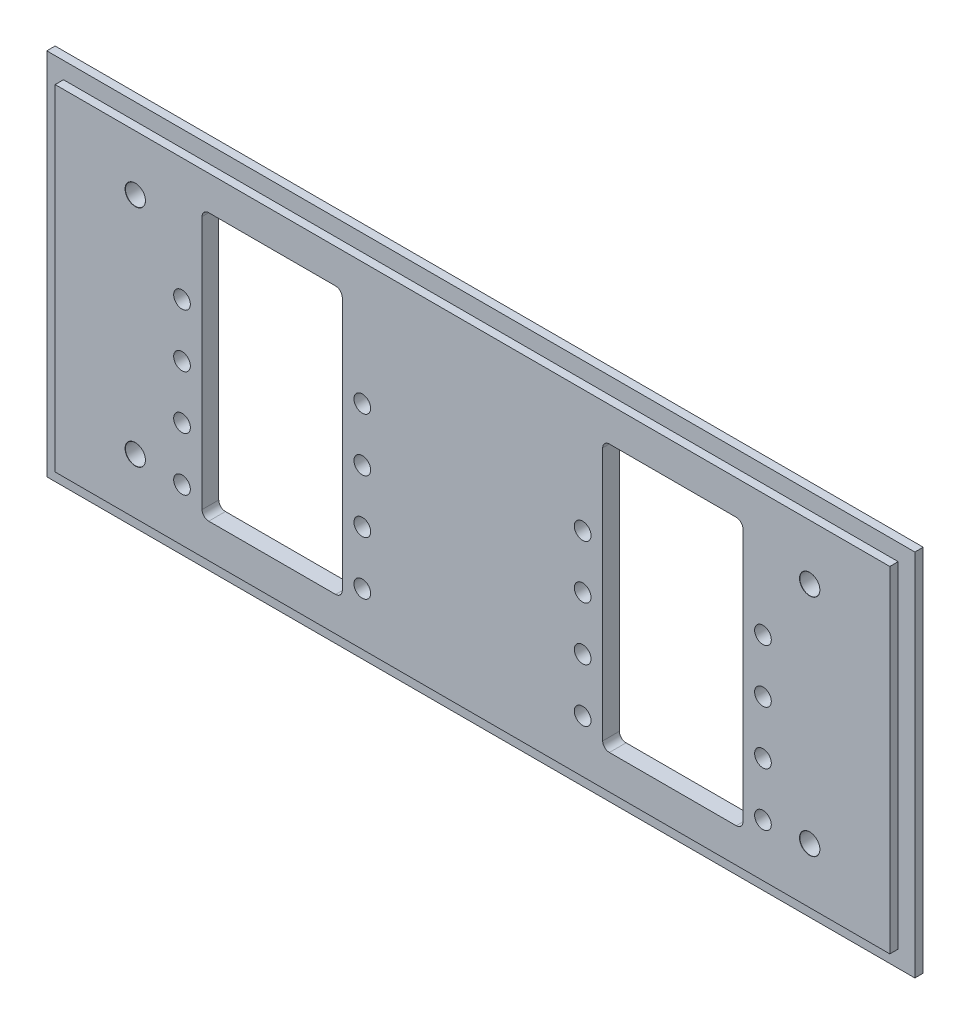
from build123d import *

# Parameters (mm, degrees)
ESBO_O1_W                         = 130
ESBO_O1_H                         = 55.25
RESSALTO_EXTRUS_O1_DEPTH          = 2.5
ESBO_O2_W                         = 130
ESBO_O2_H                         = 55.25
ESBO_O2_W_2                       = 125
ESBO_O2_H_2                       = 50.25
CORTE_EXTRUS_O1_DEPTH             = 1.25
FUROS_GUIA_COM_3_0MM2_D           = 3
FUROS_GUIA_COM_3_0MM2_CSINK_D     = 3.05
FUROS_GUIA_COM_3_0MM2_CSINK_ANGLE = 90
SKETCH1_R                         = 1.25
SKETCH1_W                         = 21
SKETCH1_H                         = 40.004104195
CUT_EXTRUDE1_DEPTH                = 10
FILETE1_R                         = 1


with BuildPart() as part:
    # Esboço1 → Ressalto-extrusão1 (new body)
    with BuildSketch(Plane.XY):
        with Locations((1.708397535, 5.726309707)):
            Rectangle(ESBO_O1_W, ESBO_O1_H)
    extrude(amount=RESSALTO_EXTRUS_O1_DEPTH)

    # Esboço2 → Corte-extrusão1 (cut)
    with BuildSketch(Plane.XY.offset(2.5)):
        with Locations((1.708397535, 5.726309707)):
            Rectangle(ESBO_O2_W, ESBO_O2_H)
        with Locations((1.708397535, 5.726309707)):
            Rectangle(ESBO_O2_W_2, ESBO_O2_H_2, mode=Mode.SUBTRACT)
    extrude(amount=-CORTE_EXTRUS_O1_DEPTH, mode=Mode.SUBTRACT)

    # Furos-guia com Ø3.0mm2 (through all)
    with Locations(Plane.XY.offset(2.5)):
        with Locations((-48.791602465, 22.551309707), (-48.791602465, -11.098690293), (52.208397535, -11.098690293), (52.208397535, 22.551309707)):
            CounterSinkHole(FUROS_GUIA_COM_3_0MM2_D / 2, FUROS_GUIA_COM_3_0MM2_CSINK_D / 2, counter_sink_angle=FUROS_GUIA_COM_3_0MM2_CSINK_ANGLE)

    # Sketch1 → Cut-Extrude1 (cut)
    with BuildSketch(Plane.XY.offset(2.5)):
        with Locations((-41.791602465, 12.476309707)):
            Circle(SKETCH1_R)
        with Locations((-41.791602465, 4.476309707)):
            Circle(SKETCH1_R)
        with Locations((-41.791602465, -3.523690293)):
            Circle(SKETCH1_R)
        with Locations((-41.791602465, -11.523690293)):
            Circle(SKETCH1_R)
        with Locations((-14.791602465, 12.476309707)):
            Circle(SKETCH1_R)
        with Locations((-14.791602465, -11.523690293)):
            Circle(SKETCH1_R)
        with Locations((-14.791602465, 4.476309707)):
            Circle(SKETCH1_R)
        with Locations((-14.791602465, -3.523690293)):
            Circle(SKETCH1_R)
        with Locations((18.208397535, -3.523690293)):
            Circle(SKETCH1_R)
        with Locations((18.208397535, 4.476309707)):
            Circle(SKETCH1_R)
        with Locations((18.208397535, -11.523690293)):
            Circle(SKETCH1_R)
        with Locations((18.208397535, 12.476309707)):
            Circle(SKETCH1_R)
        with Locations((45.208397535, -11.523690293)):
            Circle(SKETCH1_R)
        with Locations((45.208397535, -3.523690293)):
            Circle(SKETCH1_R)
        with Locations((45.208397535, 4.476309707)):
            Circle(SKETCH1_R)
        with Locations((45.208397535, 12.476309707)):
            Circle(SKETCH1_R)
        with Locations((-28.291602465, 5.728361805)):
            Rectangle(SKETCH1_W, SKETCH1_H)
        with Locations((31.708397535, 5.728361805)):
            Rectangle(SKETCH1_W, SKETCH1_H)
    extrude(amount=-CUT_EXTRUDE1_DEPTH, mode=Mode.SUBTRACT)

    # Filete1
    filete1_edges = [part.edges().sort_by_distance(p)[0] for p in [
        (42.208397535, -14.273690293, 1.25),
        (42.208397535, 25.730413902, 1.25),
        (21.208397535, 25.730413902, 1.25),
        (21.208397535, -14.273690293, 1.25),
        (-17.791602465, -14.273690293, 1.25),
        (-17.791602465, 25.730413902, 1.25),
        (-38.791602465, 25.730413902, 1.25),
        (-38.791602465, -14.273690293, 1.25),
    ]]
    fillet(filete1_edges, radius=FILETE1_R)


solid = part.part
